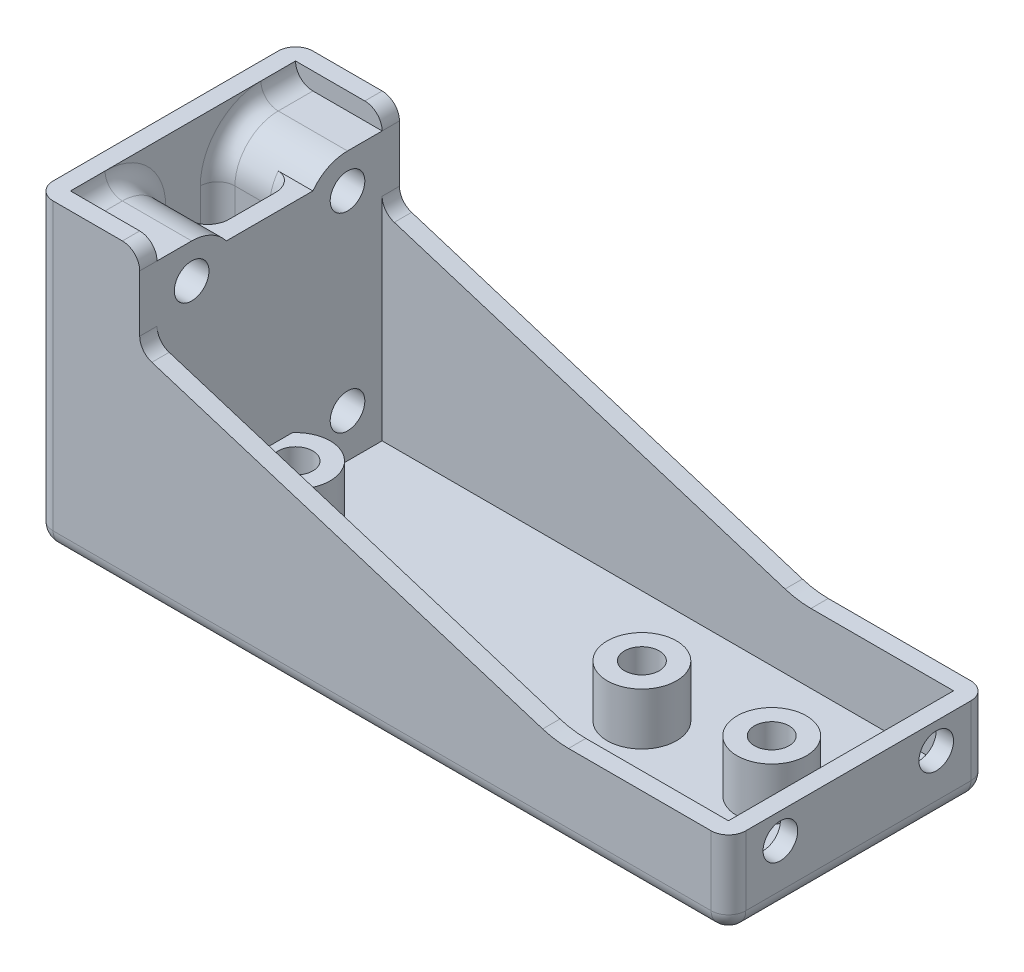
from build123d import *

# Parameters (mm, degrees)
BOSS_EXTRUDE1_DEPTH = 15
FILLET2_R           = 10
FILLET3_R           = 2
FILLET4_R           = 2
SHELL1_START        = 2
SHELL1_OUTLINE_W    = 33
SHELL1_OUTLINE_H    = 26
SHELL1_DEPTH        = 76
SKETCH2_R           = 2
CUT_EXTRUDE1_DEPTH  = 88.82938005
BOSS_EXTRUDE2_START = 6
SKETCH3_R           = 4
SKETCH3_R_2         = 2
BOSS_EXTRUDE2_DEPTH = 6
SKETCH4_W           = 26
SKETCH4_H           = 31
BOSS_EXTRUDE3_DEPTH = 10
SKETCH5_W           = 8
SKETCH5_H           = 8
CUT_EXTRUDE2_DEPTH  = 31
SKETCH6_W           = 8
SKETCH6_H           = 2
CUT_EXTRUDE3_DEPTH  = 6
FILLET5_R           = 5
FILLET6_R           = 2
SKETCH7_R           = 2
CUT_EXTRUDE4_DEPTH  = 89.600225733
CUT_EXTRUDE6_DEPTH  = 10


# Read off the part's stored shape, not the designer's step: Shell1
# Some blends are built 0.0001 mm under size
with BuildPart() as part:
    # Sketch1 → Boss-Extrude1 (new, symmetric)
    with BuildSketch(Plane.XY):
        with BuildLine():
            Line((0, 35), (0, 0))
            Line((0, 0), (80, 0))
            Line((80, 0), (80, 10))
            Line((80, 10), (60, 10))
            Line((60, 10), (13.403450014, 24.561421871))
            ThreePointArc((13.403450014, 24.561421871), (12.388618609, 25.28570887), (12, 26.470381827))
            Line((12, 26.470381827), (12, 33))
            ThreePointArc((12, 33), (11.414213562, 34.414213562), (10, 35))
            Line((10, 35), (0, 35))
        make_face()
    extrude(amount=BOSS_EXTRUDE1_DEPTH, both=True)

    # Fillet2
    fillet2_edges = [part.edges().sort_by_distance(p)[0] for p in [
        (60, 10, 0),
    ]]
    fillet(fillet2_edges, radius=FILLET2_R)

    # Fillet3
    fillet3_edges = [part.edges().sort_by_distance(p)[0] for p in [
        (80, 5, -15),
        (0, 17.5, -15),
        (80, 5, 15),
        (0, 17.5, 15),
    ]]
    fillet(fillet3_edges, radius=FILLET3_R)

    # Fillet4
    fillet4_edges = [part.edges().sort_by_distance(p)[0] for p in [
        (0, 0, 0),
        (40, 0, -15),
        (80, 0, 0),
        (40, 0, 15),
        (79.414213562, 0, 14.414213562),
        (79.414213562, 0, -14.414213562),
        (0.585786438, 0, 14.414213562),
        (0.585786438, 0, -14.414213562),
    ]]
    fillet(fillet4_edges, radius=FILLET4_R)

    # Shell1 outline → Shell1 (cut)
    with BuildSketch(Plane.YZ.offset(SHELL1_START)):
        with Locations((18.5, 0)):
            Rectangle(SHELL1_OUTLINE_W, SHELL1_OUTLINE_H)
    extrude(amount=SHELL1_DEPTH, mode=Mode.SUBTRACT)

    # Sketch2 → Cut-Extrude1 (cut, through all)
    with BuildSketch(Plane(origin=(0, 2, 0), x_dir=(1, 0, 0), z_dir=(0, 1, 0))):
        with Locations(Location((70, 0, 0), (0, 0, 270))):
            Circle(SKETCH2_R)
        with Locations(Location((55, 0, 0), (0, 0, 270))):
            Circle(SKETCH2_R)
        with Locations(Location((15, 0, 0), (0, 0, 270))):
            Circle(SKETCH2_R)
    extrude(amount=-CUT_EXTRUDE1_DEPTH, mode=Mode.SUBTRACT)

    # Sketch3 → Boss-Extrude2 (add)
    # profile 1 of 3: a face of its own
    with BuildSketch(Plane(origin=(0, 2, 0), x_dir=(1, 0, 0), z_dir=(0, 1, 0)).offset(BOSS_EXTRUDE2_START)):
        with Locations(Location((70, 0, 0), (0, 0, 270))):
            Circle(SKETCH3_R)
        with Locations(Location((70, 0, 0), (0, 0, 270))):
            Circle(SKETCH3_R_2, mode=Mode.SUBTRACT)
    # profile 2 of 3: a face of its own
    with BuildSketch(Plane(origin=(0, 2, 0), x_dir=(1, 0, 0), z_dir=(0, 1, 0)).offset(BOSS_EXTRUDE2_START)):
        with Locations(Location((55, 0, 0), (0, 0, 270))):
            Circle(SKETCH3_R)
        with Locations(Location((55, 0, 0), (0, 0, 270))):
            Circle(SKETCH3_R_2, mode=Mode.SUBTRACT)
    # profile 3 of 3: a face of its own
    with BuildSketch(Plane(origin=(0, 2, 0), x_dir=(1, 0, 0), z_dir=(0, 1, 0)).offset(BOSS_EXTRUDE2_START)):
        with Locations(Location((15, 0, 0), (0, 0, 270))):
            Circle(SKETCH3_R)
        with Locations(Location((15, 0, 0), (0, 0, 270))):
            Circle(SKETCH3_R_2, mode=Mode.SUBTRACT)
    extrude(amount=-BOSS_EXTRUDE2_DEPTH)

    # Sketch4 → Boss-Extrude3 (add)
    with BuildSketch(Plane(origin=(12, 0, 0), x_dir=(0, 0, -1), z_dir=(1, 0, 0))):
        with Locations((0, 17.5)):
            Rectangle(SKETCH4_W, SKETCH4_H)
    extrude(amount=-BOSS_EXTRUDE3_DEPTH)

    # Sketch5 → Cut-Extrude2 (cut)
    with BuildSketch(Plane(origin=(0, 33, 0), x_dir=(1, 0, 0), z_dir=(0, 1, 0))):
        with Locations((6, 0)):
            Rectangle(SKETCH5_W, SKETCH5_H)
    extrude(amount=-CUT_EXTRUDE2_DEPTH, mode=Mode.SUBTRACT)

    # Sketch6 → Cut-Extrude3 (cut)
    with BuildSketch(Plane.ZY.offset(-10)):
        with Locations((0, 32)):
            Rectangle(SKETCH6_W, SKETCH6_H)
    extrude(amount=-CUT_EXTRUDE3_DEPTH, mode=Mode.SUBTRACT)

    # Fillet5
    # the kernel refuses this fillet: 5 mm, written as the material it takes off along each edge
    with BuildSketch(Plane(origin=(24.5, 33, -4), x_dir=(0, 0, -1), z_dir=(-1, 0, 0))) as fillet5_piece_1_section:
        with BuildLine():
            CenterArc((FILLET5_R, FILLET5_R), FILLET5_R, 180, 90)
            Line((0, FILLET5_R), (0, 0))
            Line((0, 0), (FILLET5_R, 0))
        make_face()
    fillet5_piece_1 = extrude(amount=22.5, mode=Mode.PRIVATE)
    fillet5_piece_1 = split(fillet5_piece_1, bisect_by=Plane(origin=(11, 31, -5.295296425), z_dir=(0, 1, 0)), keep=Keep.TOP, mode=Mode.PRIVATE)
    add(fillet5_piece_1, mode=Mode.SUBTRACT)
    with BuildSketch(Plane(origin=(24.5, 33, -4), x_dir=(0, 0, -1), z_dir=(-1, 0, 0))) as fillet5_piece_2_section:
        with BuildLine():
            CenterArc((FILLET5_R, FILLET5_R), FILLET5_R, 180, 90)
            Line((0, FILLET5_R), (0, 0))
            Line((0, 0), (FILLET5_R, 0))
        make_face()
    fillet5_piece_2 = extrude(amount=22.5, mode=Mode.PRIVATE)
    fillet5_piece_2 = split(fillet5_piece_2, bisect_by=Plane(origin=(10, 30.265828048, -4.294049439), z_dir=(-1, 0, 0)), keep=Keep.TOP, mode=Mode.PRIVATE)
    add(fillet5_piece_2, mode=Mode.SUBTRACT)
    with BuildSketch(Plane(origin=(24.5, 33, 4), x_dir=(0, -1, 0), z_dir=(-1, 0, 0))) as fillet5_piece_3_section:
        with BuildLine():
            CenterArc((FILLET5_R, FILLET5_R), FILLET5_R, 180, 90)
            Line((0, FILLET5_R), (0, 0))
            Line((0, 0), (FILLET5_R, 0))
        make_face()
    fillet5_piece_3 = extrude(amount=22.5, mode=Mode.PRIVATE)
    fillet5_piece_3 = split(fillet5_piece_3, bisect_by=Plane(origin=(11, 31, 5.295296425), z_dir=(0, 1, 0)), keep=Keep.TOP, mode=Mode.PRIVATE)
    add(fillet5_piece_3, mode=Mode.SUBTRACT)
    with BuildSketch(Plane(origin=(24.5, 33, 4), x_dir=(0, -1, 0), z_dir=(-1, 0, 0))) as fillet5_piece_4_section:
        with BuildLine():
            CenterArc((FILLET5_R, FILLET5_R), FILLET5_R, 180, 90)
            Line((0, FILLET5_R), (0, 0))
            Line((0, 0), (FILLET5_R, 0))
        make_face()
    fillet5_piece_4 = extrude(amount=22.5, mode=Mode.PRIVATE)
    fillet5_piece_4 = split(fillet5_piece_4, bisect_by=Plane(origin=(10, 30.265828048, 4.294049439), z_dir=(-1, 0, 0)), keep=Keep.TOP, mode=Mode.PRIVATE)
    add(fillet5_piece_4, mode=Mode.SUBTRACT)

    # Fillet6
    fillet6_edges = [part.edges().sort_by_distance(p)[0] for p in [
        (2, 33, -11),
        (2, 31.535533906, -5.464466094),
        (10, 29.58113883, -4.25658351),
        (2, 33, 11),
        (2, 31.535533906, 5.464466094),
        (2, 15, -4),
        (10, 15, -4),
        (2, 15, 4),
        (10, 29.58113883, 4.25658351),
        (6, 2, 4),
        (10, 15, 4),
    ]]
    fillet(fillet6_edges, radius=FILLET6_R - 0.0001)  # a hair under: the kernel refuses the full size

    # Sketch7 → Cut-Extrude4 (cut, through all)
    with BuildSketch(Plane.ZY):
        with Locations(Location((-9, 29, 0), (0, 0, 270))):
            Circle(SKETCH7_R)
        with Locations(Location((-9, 7, 0), (0, 0, 270))):
            Circle(SKETCH7_R)
        with Locations((9, 7)):
            Circle(SKETCH7_R)
        with Locations((9, 29)):
            Circle(SKETCH7_R)
    extrude(amount=-CUT_EXTRUDE4_DEPTH, mode=Mode.SUBTRACT)

    # Sketch8 → Cut-Extrude6 (cut)
    with BuildSketch(Plane.ZY):
        with BuildLine():
            Line((-11.5, 13), (-11.5, 23))
            ThreePointArc((-11.5, 23), (-9, 25.5), (-6.5, 23))
            Line((-6.5, 23), (-6.5, 13))
            ThreePointArc((-6.5, 13), (-9, 10.5), (-11.5, 13))
        make_face()
        with BuildLine():
            Line((11.5, 13), (11.5, 23))
            ThreePointArc((11.5, 23), (9, 25.5), (6.5, 23))
            Line((6.5, 23), (6.5, 13))
            ThreePointArc((6.5, 13), (9, 10.5), (11.5, 13))
        make_face()
    extrude(amount=-CUT_EXTRUDE6_DEPTH, mode=Mode.SUBTRACT)


solid = part.part
